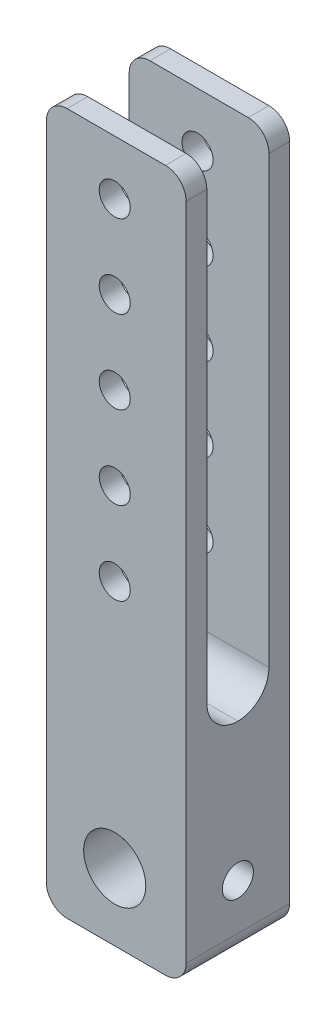
from build123d import *

# Parameters (mm, degrees)
SKETCH1_W           = 21.43125
SKETCH1_H           = 107.553125
SKETCH1_R           = 4.7625
SKETCH1_R_2         = 2.38125
BOSS_EXTRUDE3_DEPTH = 15.875
FILLET1_R           = 3.175
FILLET2_R           = 3.175
FILLET3_R           = 3.175
FILLET4_R           = 3.175
SKETCH3_W           = 9.525
SKETCH3_H           = 76.2
CUT_EXTRUDE2_DEPTH  = 111.810598766
FILLET5_R           = 4.7625
FILLET6_R           = 4.7625
SKETCH5_R           = 2.38125
CUT_EXTRUDE3_DEPTH  = 21.43125


with BuildPart() as part:
    # Sketch1 → Boss-Extrude3 (new body)
    with BuildSketch(Plane.XY):
        with Locations((10.715625, 53.7765625)):
            Rectangle(SKETCH1_W, SKETCH1_H)
        with Locations((10.484595663, 10.31875)):
            Circle(SKETCH1_R, mode=Mode.SUBTRACT)
        with Locations((10.484595663, 99.21875)):
            Circle(SKETCH1_R_2, mode=Mode.SUBTRACT)
        with Locations((10.484595663, 86.51875)):
            Circle(SKETCH1_R_2, mode=Mode.SUBTRACT)
        with Locations((10.484595663, 73.81875)):
            Circle(SKETCH1_R_2, mode=Mode.SUBTRACT)
        with Locations((10.484595663, 61.11875)):
            Circle(SKETCH1_R_2, mode=Mode.SUBTRACT)
        with Locations((10.484595663, 48.41875)):
            Circle(SKETCH1_R_2, mode=Mode.SUBTRACT)
    extrude(amount=BOSS_EXTRUDE3_DEPTH)

    # Fillet1
    fillet1_edges = [part.edges().sort_by_distance(p)[0] for p in [
        (21.43125, 0, 7.9375),
    ]]
    fillet(fillet1_edges, radius=FILLET1_R)

    # Fillet2
    fillet2_edges = [part.edges().sort_by_distance(p)[0] for p in [
        (0, 0, 7.9375),
    ]]
    fillet(fillet2_edges, radius=FILLET2_R)

    # Fillet3
    fillet3_edges = [part.edges().sort_by_distance(p)[0] for p in [
        (21.43125, 107.553125, 7.9375),
    ]]
    fillet(fillet3_edges, radius=FILLET3_R)

    # Fillet4
    fillet4_edges = [part.edges().sort_by_distance(p)[0] for p in [
        (0, 107.553125, 7.9375),
    ]]
    fillet(fillet4_edges, radius=FILLET4_R)

    # Sketch3 → Cut-Extrude2 (cut, through all)
    with BuildSketch(Plane(origin=(0, 0, 0), x_dir=(0, 0, -1), z_dir=(1, 0, 0))):
        with Locations((-7.9375, 69.453125)):
            Rectangle(SKETCH3_W, SKETCH3_H)
    extrude(amount=CUT_EXTRUDE2_DEPTH, mode=Mode.SUBTRACT)

    # Fillet5
    fillet5_edges = [part.edges().sort_by_distance(p)[0] for p in [
        (10.715625, 31.353125, 3.175),
    ]]
    fillet(fillet5_edges, radius=FILLET5_R)

    # Fillet6
    fillet6_edges = [part.edges().sort_by_distance(p)[0] for p in [
        (10.715625, 31.353125, 12.7),
    ]]
    fillet(fillet6_edges, radius=FILLET6_R - 0.0001)  # a hair under: the kernel refuses the full size

    # Sketch5 → Cut-Extrude3 (cut)
    with BuildSketch(Plane(origin=(0, 0, 0), x_dir=(0, 0, -1), z_dir=(1, 0, 0))):
        with Locations(Location((-7.9375, 10.20445, 0), (0, 0, 180))):
            Circle(SKETCH5_R)
    extrude(amount=CUT_EXTRUDE3_DEPTH, mode=Mode.SUBTRACT)


solid = part.part
